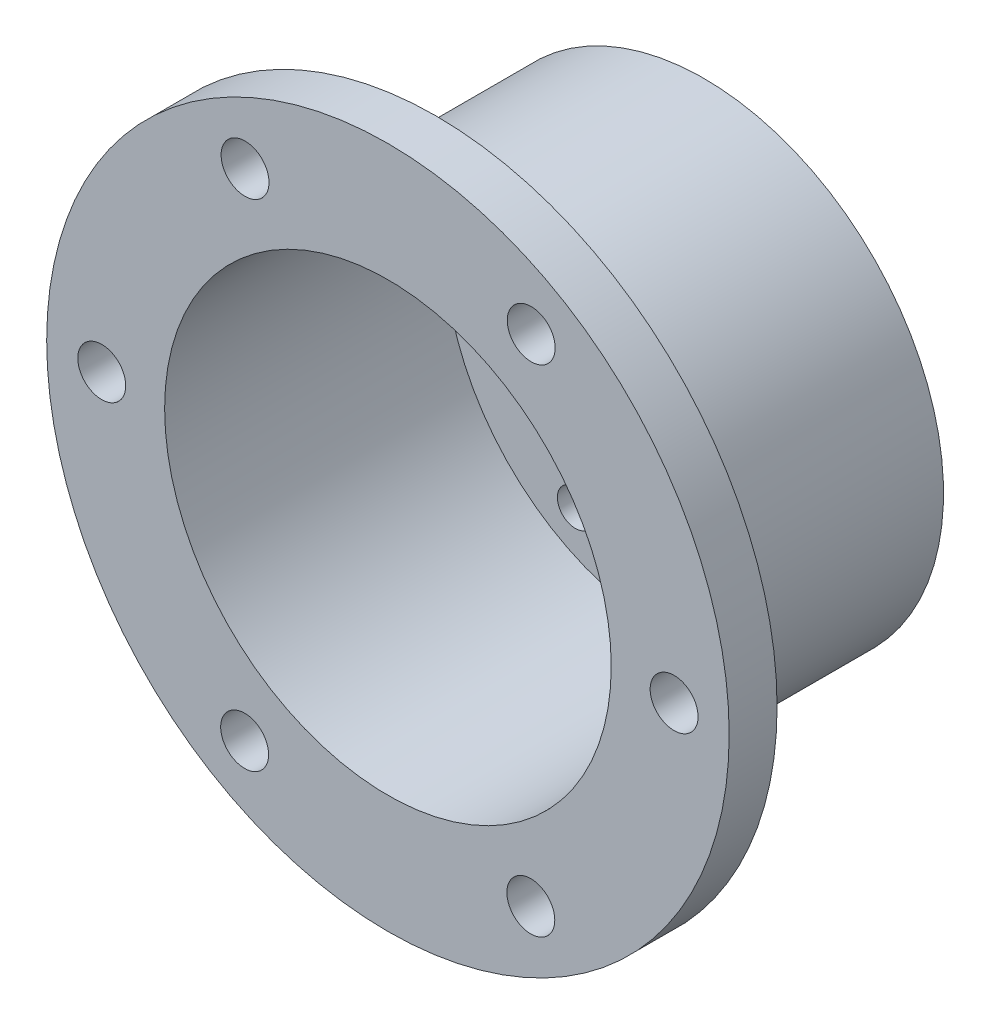
from build123d import *

# Parameters (mm, degrees)
CROQUIS1_R              = 21.4
CROQUIS1_R_2            = 18.65
SALIENTE_EXTRUIR1_DEPTH = 26.4
CROQUIS2_R              = 18.65
SALIENTE_EXTRUIR2_DEPTH = 3
SALIENTE_EXTRUIR3_START = -4
CROQUIS3_R              = 28.5
CROQUIS3_R_2            = 21.4
SALIENTE_EXTRUIR3_DEPTH = 4
CROQUIS4_R              = 6
CROQUIS4_R_2            = 1.5
CORTAR_EXTRUIR1_DEPTH   = 3
CROQUIS6_R              = 2
CORTAR_EXTRUIR2_DEPTH   = 49.181531732
CROQUIS7_R              = 21.4
CROQUIS7_R_2            = 20
CORTAR_EXTRUIR3_DEPTH   = 22.4


with BuildPart() as part:
    # Croquis1 → Saliente-Extruir1 (new body)
    with BuildSketch(Plane.XY):
        Circle(CROQUIS1_R)
        Circle(CROQUIS1_R_2, mode=Mode.SUBTRACT)
    extrude(amount=SALIENTE_EXTRUIR1_DEPTH)

    # Croquis2 → Saliente-Extruir2 (add)
    with BuildSketch(Plane(origin=(0, 0, 0), x_dir=(-1, 0, 0), z_dir=(0, 0, -1))):
        Circle(CROQUIS2_R)
    extrude(amount=-SALIENTE_EXTRUIR2_DEPTH)

    # Croquis3 → Saliente-Extruir3 (add)
    with BuildSketch(Plane.XY.offset(26.4).offset(SALIENTE_EXTRUIR3_START)):
        Circle(CROQUIS3_R)
        Circle(CROQUIS3_R_2, mode=Mode.SUBTRACT)
    extrude(amount=SALIENTE_EXTRUIR3_DEPTH)

    # Croquis4 → Cortar-Extruir1 (cut)
    with BuildSketch(Plane(origin=(0, 0, 0), x_dir=(-1, 0, 0), z_dir=(0, 0, -1))):
        with Locations((0, -7)):
            Circle(CROQUIS4_R)
        with Locations((-15.5, 0)):
            Circle(CROQUIS4_R_2)
        with Locations((-7.75, 13.423393759)):
            Circle(CROQUIS4_R_2)
        with Locations((7.75, 13.423393759)):
            Circle(CROQUIS4_R_2)
        with Locations((15.5, 0)):
            Circle(CROQUIS4_R_2)
        with Locations((7.75, -13.423393759)):
            Circle(CROQUIS4_R_2)
        with Locations((-7.75, -13.423393759)):
            Circle(CROQUIS4_R_2)
    extrude(amount=-CORTAR_EXTRUIR1_DEPTH, mode=Mode.SUBTRACT)

    # Croquis6 → Cortar-Extruir2 (cut, through all)
    with BuildSketch(Plane.XY.offset(26.4)):
        with Locations((11.96671541, 20.688356504)):
            Circle(CROQUIS6_R)
        with Locations((23.9, -0.019301293)):
            Circle(CROQUIS6_R)
        with Locations((-11.93328459, 20.707657797)):
            Circle(CROQUIS6_R)
        with Locations((11.93328459, -20.707657797)):
            Circle(CROQUIS6_R)
        with Locations((-11.96671541, -20.688356504)):
            Circle(CROQUIS6_R)
        with Locations((-23.9, 0.019301293)):
            Circle(CROQUIS6_R)
    extrude(amount=-CORTAR_EXTRUIR2_DEPTH, mode=Mode.SUBTRACT)

    # Croquis7 → Cortar-Extruir3 (cut)
    with BuildSketch(Plane(origin=(0, 0, 0), x_dir=(-1, 0, 0), z_dir=(0, 0, -1))):
        Circle(CROQUIS7_R)
        Circle(CROQUIS7_R_2, mode=Mode.SUBTRACT)
    extrude(amount=-CORTAR_EXTRUIR3_DEPTH, mode=Mode.SUBTRACT)


solid = part.part
